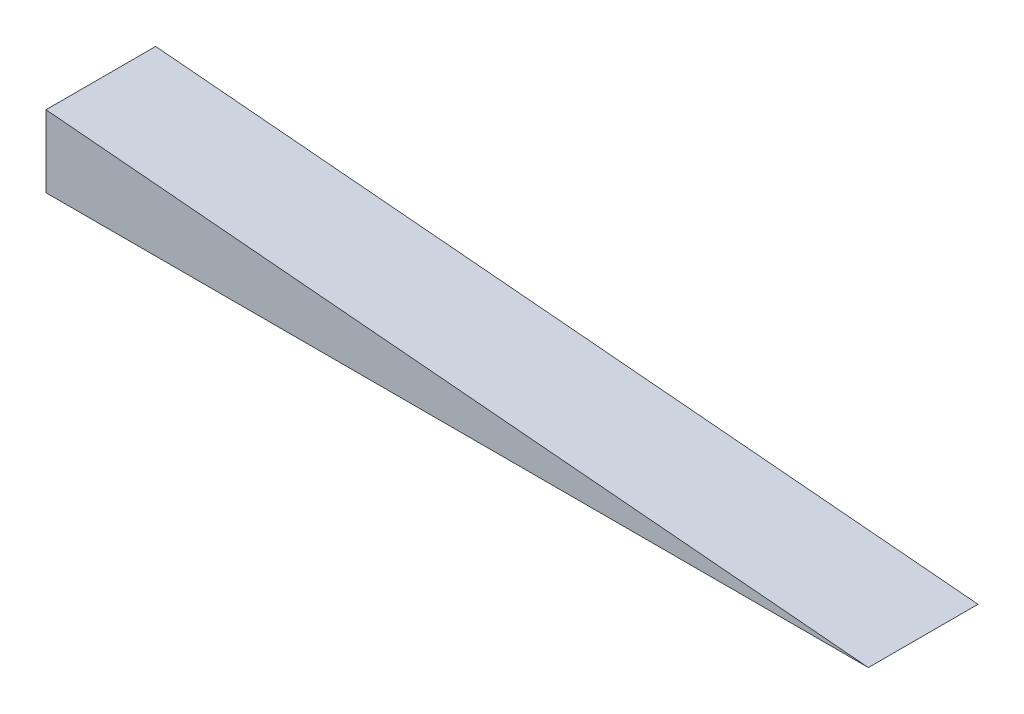
from build123d import *

# Parameters (mm, degrees)
BOSS_EXTRUDE1_DEPTH = 10


with BuildPart() as part:
    # Sketch1 → Boss-Extrude1 (new, symmetric)
    with BuildSketch(Plane.XY):
        Polygon((-49.027757444, 0), (100.972242556, 0), (-49.027757444, 13.123299529), align=None)
    extrude(amount=BOSS_EXTRUDE1_DEPTH, both=True)


solid = part.part
